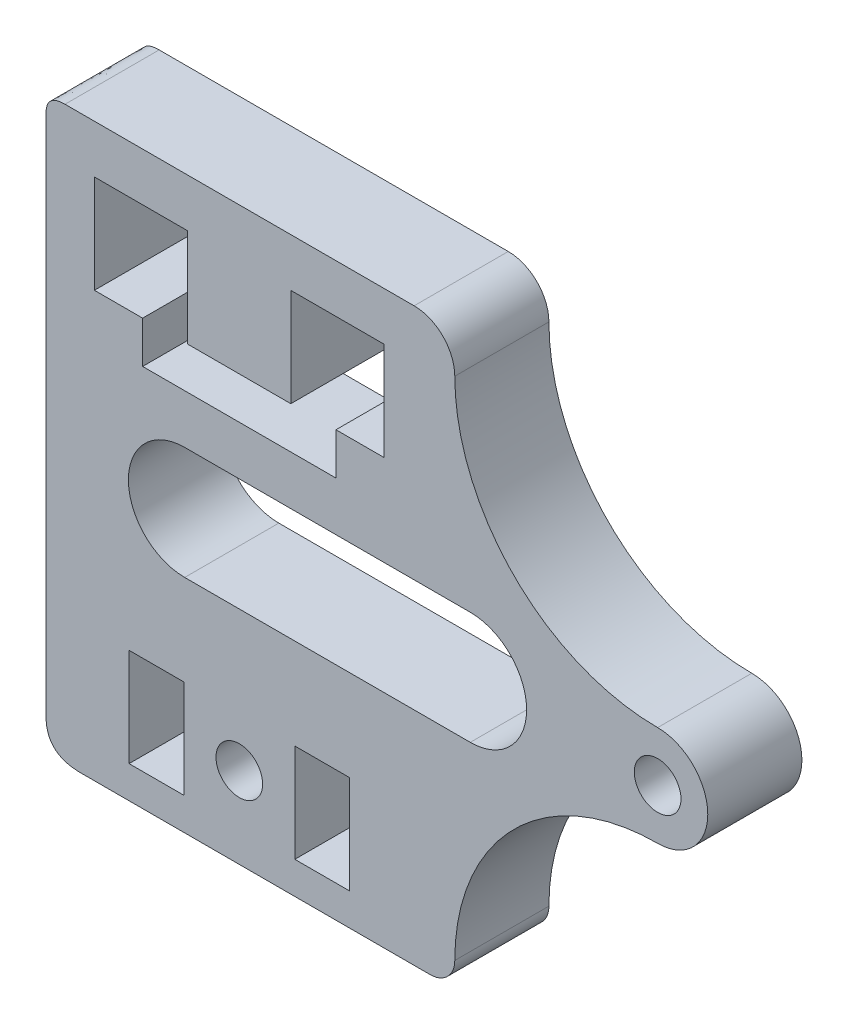
from build123d import *

# Parameters (mm, degrees)
SKETCH1_R           = 1.45
SKETCH1_W           = 3.400011
SKETCH1_H           = 6.1
BOSS_EXTRUDE2_DEPTH = 5.85
SKETCH2_R           = 1.25
CUT_EXTRUDE1_DEPTH  = 1


with BuildPart() as part:
    # Sketch1 → Boss-Extrude2 (new body)
    with BuildSketch(Plane.XY):
        with BuildLine():
            Line((388.728053772, 562.888903138), (410.424633118, 562.888903138))
            ThreePointArc((410.424633118, 562.888903138), (412.211329852, 562.148829119), (412.95140387, 560.362132386))
            ThreePointArc((412.95140387, 560.362132386), (416.644097047, 551.447182437), (425.559046996, 547.75448926))
            ThreePointArc((425.559046996, 547.75448926), (428.674633119, 544.638903138), (425.559046996, 541.523317015))
            ThreePointArc((425.559046996, 541.523317015), (416.644097047, 537.830623838), (412.95140387, 528.915673889))
            ThreePointArc((412.95140387, 528.915673889), (412.50422307, 527.836083937), (411.424633118, 527.388903138))
            Line((411.424633118, 527.388903138), (389.728053772, 527.388903138))
            add(Edge.make_bspline(
                [(387.555122745, 529.559612039), (387.43552985, 527.388903138), (389.728053772, 527.388903138)],
                knots=[0, 0, 0, 1, 1, 1], degree=2))
            Line((387.555122745, 529.559612039), (387.555122745, 561.717171015))
            add(Edge.make_bspline(
                [(387.555122745, 561.717171015), (387.490566794, 562.888903138), (388.728053772, 562.888903138)],
                knots=[0, 0, 0, 1, 1, 1], degree=2))
        make_face()
        with Locations((425.559046996, 544.638903138)):
            Circle(SKETCH1_R, mode=Mode.SUBTRACT)
        with Locations((399.559046996, 532.438903138)):
            Circle(SKETCH1_R, mode=Mode.SUBTRACT)
        Polygon((405.566920996, 551.188903138), (405.566920996, 553.788903138), (408.562971247, 553.788903138), (408.562971247, 559.888903138), (402.762971247, 559.888903138), (402.762971247, 553.788903138), (396.355122745, 553.788903138), (396.355122745, 559.888903138), (390.555122745, 559.888903138), (390.555122745, 553.788903138), (393.551172996, 553.788903138), (393.551172996, 551.188903138), align=None, mode=Mode.SUBTRACT)
        with Locations((394.409041496, 532.438903138)):
            Rectangle(SKETCH1_W, SKETCH1_H, mode=Mode.SUBTRACT)
        with Locations((404.709052496, 532.438903138)):
            Rectangle(SKETCH1_W, SKETCH1_H, mode=Mode.SUBTRACT)
        with BuildLine():
            Line((396.165690223, 548.138903138), (413.915690223, 548.138903138))
            ThreePointArc((413.915690223, 548.138903138), (417.415690223, 544.638903138), (413.915690223, 541.138903138))
            Line((413.915690223, 541.138903138), (396.165690223, 541.138903138))
            ThreePointArc((396.165690223, 541.138903138), (392.665690223, 544.638903138), (396.165690223, 548.138903138))
        make_face(mode=Mode.SUBTRACT)
    extrude(amount=BOSS_EXTRUDE2_DEPTH)

    # Sketch2 → Cut-Extrude1 (cut)
    with BuildSketch(Plane.XY):
        with Locations((409.659057996, 532.438903138)):
            Circle(SKETCH2_R)
    extrude(amount=CUT_EXTRUDE1_DEPTH, mode=Mode.SUBTRACT)


solid = part.part
